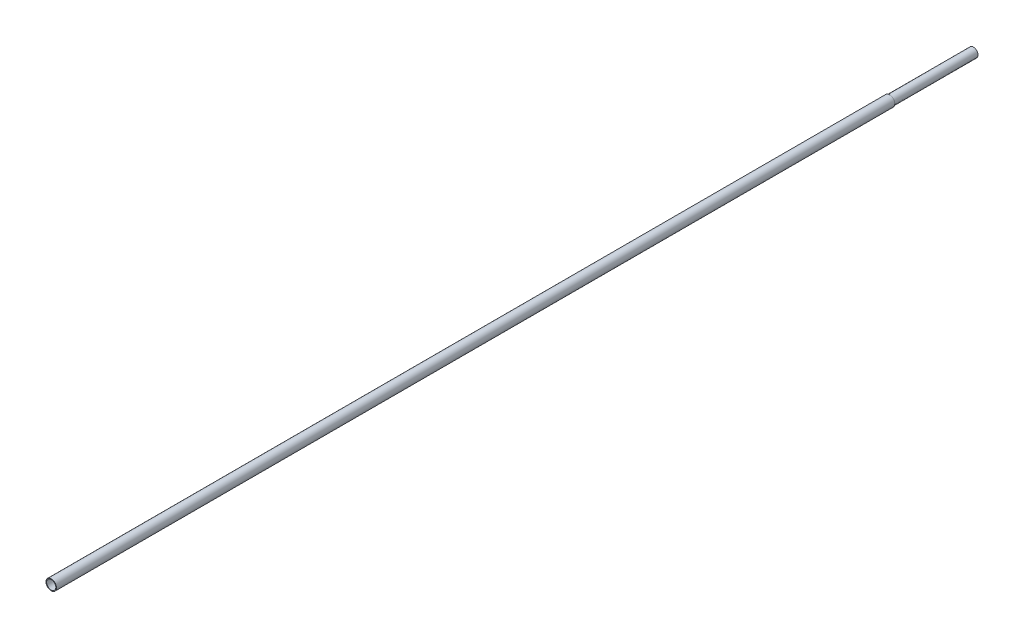
from build123d import *

# Parameters (mm, degrees)
SKETCH1_R                  = 25.4
SKETCH1_R_2                = 22.225
BOSS_EXTRUDE1_DEPTH        = 4064
SKETCH2_R                  = 6.35
CUT_EXTRUDE1_DEPTH         = 4065.1587469
LPATTERN1_COUNT            = 8
LPATTERN1_PITCH            = 25.4
LPATTERN2_COPY_1_SKETCH_R  = 6.35
LPATTERN2_COPY_1_DEPTH     = 4065.1587469
LPATTERN2_COPY_2_SKETCH_R  = 6.35
LPATTERN2_COPY_2_DEPTH     = 4065.1587469
LPATTERN2_COPY_3_SKETCH_R  = 6.35
LPATTERN2_COPY_3_DEPTH     = 4065.1587469
LPATTERN2_COPY_4_SKETCH_R  = 6.35
LPATTERN2_COPY_4_DEPTH     = 4065.1587469
LPATTERN2_COPY_5_SKETCH_R  = 6.35
LPATTERN2_COPY_5_DEPTH     = 4065.1587469
LPATTERN2_COPY_6_SKETCH_R  = 6.35
LPATTERN2_COPY_6_DEPTH     = 4065.1587469
LPATTERN2_COPY_7_SKETCH_R  = 6.35
LPATTERN2_COPY_7_DEPTH     = 4065.1587469
LPATTERN2_COPY_8_SKETCH_R  = 6.35
LPATTERN2_COPY_8_DEPTH     = 4065.1587469
LPATTERN2_COPY_9_SKETCH_R  = 6.35
LPATTERN2_COPY_9_DEPTH     = 4065.1587469
LPATTERN2_COPY_10_SKETCH_R = 6.35
LPATTERN2_COPY_10_DEPTH    = 4065.1587469
LPATTERN2_COPY_11_SKETCH_R = 6.35
LPATTERN2_COPY_11_DEPTH    = 4065.1587469
LPATTERN2_COPY_12_SKETCH_R = 6.35
LPATTERN2_COPY_12_DEPTH    = 4065.1587469
LPATTERN2_COPY_13_SKETCH_R = 6.35
LPATTERN2_COPY_13_DEPTH    = 4065.1587469
LPATTERN2_COPY_14_SKETCH_R = 6.35
LPATTERN2_COPY_14_DEPTH    = 4065.1587469
LPATTERN2_COPY_15_SKETCH_R = 6.35
LPATTERN2_COPY_15_DEPTH    = 4065.1587469
LPATTERN2_COPY_16_SKETCH_R = 6.35
LPATTERN2_COPY_16_DEPTH    = 4065.1587469
LPATTERN2_COPY_17_SKETCH_R = 6.35
LPATTERN2_COPY_17_DEPTH    = 4065.1587469
LPATTERN2_COPY_18_SKETCH_R = 6.35
LPATTERN2_COPY_18_DEPTH    = 4065.1587469
LPATTERN2_COPY_19_SKETCH_R = 6.35
LPATTERN2_COPY_19_DEPTH    = 4065.1587469
LPATTERN2_COPY_20_SKETCH_R = 6.35
LPATTERN2_COPY_20_DEPTH    = 4065.1587469
LPATTERN2_COPY_21_SKETCH_R = 6.35
LPATTERN2_COPY_21_DEPTH    = 4065.1587469
LPATTERN2_COPY_22_SKETCH_R = 6.35
LPATTERN2_COPY_22_DEPTH    = 4065.1587469
LPATTERN2_COPY_23_SKETCH_R = 6.35
LPATTERN2_COPY_23_DEPTH    = 4065.1587469
LPATTERN2_COPY_24_SKETCH_R = 6.35
LPATTERN2_COPY_24_DEPTH    = 4065.1587469
LPATTERN2_COPY_25_SKETCH_R = 6.35
LPATTERN2_COPY_25_DEPTH    = 4065.1587469
LPATTERN2_COPY_26_SKETCH_R = 6.35
LPATTERN2_COPY_26_DEPTH    = 4065.1587469
LPATTERN2_COPY_27_SKETCH_R = 6.35
LPATTERN2_COPY_27_DEPTH    = 4065.1587469
LPATTERN2_COPY_28_SKETCH_R = 6.35
LPATTERN2_COPY_28_DEPTH    = 4065.1587469
LPATTERN2_COPY_29_SKETCH_R = 6.35
LPATTERN2_COPY_29_DEPTH    = 4065.1587469
LPATTERN2_COPY_30_SKETCH_R = 6.35
LPATTERN2_COPY_30_DEPTH    = 4065.1587469
LPATTERN2_COPY_31_SKETCH_R = 6.35
LPATTERN2_COPY_31_DEPTH    = 4065.1587469
LPATTERN2_COPY_32_SKETCH_R = 6.35
LPATTERN2_COPY_32_DEPTH    = 4065.1587469
LPATTERN2_COPY_33_SKETCH_R = 6.35
LPATTERN2_COPY_33_DEPTH    = 4065.1587469
LPATTERN2_COPY_34_SKETCH_R = 6.35
LPATTERN2_COPY_34_DEPTH    = 4065.1587469
LPATTERN2_COPY_35_SKETCH_R = 6.35
LPATTERN2_COPY_35_DEPTH    = 4065.1587469
LPATTERN2_COPY_36_SKETCH_R = 6.35
LPATTERN2_COPY_36_DEPTH    = 4065.1587469
LPATTERN2_COPY_37_SKETCH_R = 6.35
LPATTERN2_COPY_37_DEPTH    = 4065.1587469
LPATTERN2_COPY_38_SKETCH_R = 6.35
LPATTERN2_COPY_38_DEPTH    = 4065.1587469
LPATTERN2_COPY_39_SKETCH_R = 6.35
LPATTERN2_COPY_39_DEPTH    = 4065.1587469
LPATTERN2_COPY_40_SKETCH_R = 6.35
LPATTERN2_COPY_40_DEPTH    = 4065.1587469
LPATTERN2_COPY_41_SKETCH_R = 6.35
LPATTERN2_COPY_41_DEPTH    = 4065.1587469
LPATTERN2_COPY_42_SKETCH_R = 6.35
LPATTERN2_COPY_42_DEPTH    = 4065.1587469
LPATTERN2_COPY_43_SKETCH_R = 6.35
LPATTERN2_COPY_43_DEPTH    = 4065.1587469
LPATTERN2_COPY_44_SKETCH_R = 6.35
LPATTERN2_COPY_44_DEPTH    = 4065.1587469
LPATTERN2_COPY_45_SKETCH_R = 6.35
LPATTERN2_COPY_45_DEPTH    = 4065.1587469
LPATTERN2_COPY_46_SKETCH_R = 6.35
LPATTERN2_COPY_46_DEPTH    = 4065.1587469
LPATTERN2_COPY_47_SKETCH_R = 6.35
LPATTERN2_COPY_47_DEPTH    = 4065.1587469
LPATTERN2_COPY_48_SKETCH_R = 6.35
LPATTERN2_COPY_48_DEPTH    = 4065.1587469
LPATTERN2_COPY_49_SKETCH_R = 6.35
LPATTERN2_COPY_49_DEPTH    = 4065.1587469
LPATTERN2_COPY_50_SKETCH_R = 6.35
LPATTERN2_COPY_50_DEPTH    = 4065.1587469
LPATTERN2_COPY_51_SKETCH_R = 6.35
LPATTERN2_COPY_51_DEPTH    = 4065.1587469
LPATTERN2_COPY_52_SKETCH_R = 6.35
LPATTERN2_COPY_52_DEPTH    = 4065.1587469
LPATTERN2_COPY_53_SKETCH_R = 6.35
LPATTERN2_COPY_53_DEPTH    = 4065.1587469
LPATTERN2_COPY_54_SKETCH_R = 6.35
LPATTERN2_COPY_54_DEPTH    = 4065.1587469
LPATTERN2_COPY_55_SKETCH_R = 6.35
LPATTERN2_COPY_55_DEPTH    = 4065.1587469
LPATTERN2_COPY_56_SKETCH_R = 6.35
LPATTERN2_COPY_56_DEPTH    = 4065.1587469
SKETCH3_R                  = 22.225
SKETCH3_R_2                = 19.05
BOSS_EXTRUDE2_DEPTH        = 406.4


with BuildPart() as part:
    # Sketch1 → Boss-Extrude1 (new body)
    with BuildSketch(Plane.XY):
        Circle(SKETCH1_R)
        Circle(SKETCH1_R_2, mode=Mode.SUBTRACT)
    extrude(amount=BOSS_EXTRUDE1_DEPTH)

    # Sketch2 → Cut-Extrude1 (cut, through all)
    with BuildSketch(Plane(origin=(0, 0, 0), x_dir=(1, 0, 0), z_dir=(0, 1, 0))):
        with Locations((0, -152.4)):
            Circle(SKETCH2_R)
    cut_extrude1 = extrude(amount=-CUT_EXTRUDE1_DEPTH, mode=Mode.SUBTRACT)

    # LPattern1: Cut-Extrude1 ×8
    with Locations(*[(0, 0, i * LPATTERN1_PITCH) for i in range(1, LPATTERN1_COUNT)]):
        add(cut_extrude1, mode=Mode.SUBTRACT)

    # LPattern2 copy 1 sketch → LPattern2 copy 1 (cut, through all)
    with BuildSketch(Plane(origin=(0, 0, 635), x_dir=(1, 0, 0), z_dir=(0, 1, 0))):
        with Locations((0, -152.4)):
            Circle(LPATTERN2_COPY_1_SKETCH_R)
    extrude(amount=-LPATTERN2_COPY_1_DEPTH, mode=Mode.SUBTRACT)

    # LPattern2 copy 2 sketch → LPattern2 copy 2 (cut, through all)
    with BuildSketch(Plane(origin=(0, 0, 1244.6), x_dir=(1, 0, 0), z_dir=(0, 1, 0))):
        with Locations((0, -152.4)):
            Circle(LPATTERN2_COPY_2_SKETCH_R)
    extrude(amount=-LPATTERN2_COPY_2_DEPTH, mode=Mode.SUBTRACT)

    # LPattern2 copy 3 sketch → LPattern2 copy 3 (cut, through all)
    with BuildSketch(Plane(origin=(0, 0, 1854.2), x_dir=(1, 0, 0), z_dir=(0, 1, 0))):
        with Locations((0, -152.4)):
            Circle(LPATTERN2_COPY_3_SKETCH_R)
    extrude(amount=-LPATTERN2_COPY_3_DEPTH, mode=Mode.SUBTRACT)

    # LPattern2 copy 4 sketch → LPattern2 copy 4 (cut, through all)
    with BuildSketch(Plane(origin=(0, 0, 2463.8), x_dir=(1, 0, 0), z_dir=(0, 1, 0))):
        with Locations((0, -152.4)):
            Circle(LPATTERN2_COPY_4_SKETCH_R)
    extrude(amount=-LPATTERN2_COPY_4_DEPTH, mode=Mode.SUBTRACT)

    # LPattern2 copy 5 sketch → LPattern2 copy 5 (cut, through all)
    with BuildSketch(Plane(origin=(0, 0, 3073.4), x_dir=(1, 0, 0), z_dir=(0, 1, 0))):
        with Locations((0, -152.4)):
            Circle(LPATTERN2_COPY_5_SKETCH_R)
    extrude(amount=-LPATTERN2_COPY_5_DEPTH, mode=Mode.SUBTRACT)

    # LPattern2 copy 6 sketch → LPattern2 copy 6 (cut, through all)
    with BuildSketch(Plane(origin=(0, 0, 3683), x_dir=(1, 0, 0), z_dir=(0, 1, 0))):
        with Locations((0, -152.4)):
            Circle(LPATTERN2_COPY_6_SKETCH_R)
    extrude(amount=-LPATTERN2_COPY_6_DEPTH, mode=Mode.SUBTRACT)

    # LPattern2 copy 7 sketch → LPattern2 copy 7 (cut, through all)
    with BuildSketch(Plane(origin=(0, 0, 4292.6), x_dir=(1, 0, 0), z_dir=(0, 1, 0))):
        with Locations((0, -152.4)):
            Circle(LPATTERN2_COPY_7_SKETCH_R)
    extrude(amount=-LPATTERN2_COPY_7_DEPTH, mode=Mode.SUBTRACT)

    # LPattern2 copy 8 sketch → LPattern2 copy 8 (cut, through all)
    with BuildSketch(Plane(origin=(0, 0, 660.4), x_dir=(1, 0, 0), z_dir=(0, 1, 0))):
        with Locations((0, -152.4)):
            Circle(LPATTERN2_COPY_8_SKETCH_R)
    extrude(amount=-LPATTERN2_COPY_8_DEPTH, mode=Mode.SUBTRACT)

    # LPattern2 copy 9 sketch → LPattern2 copy 9 (cut, through all)
    with BuildSketch(Plane(origin=(0, 0, 1270), x_dir=(1, 0, 0), z_dir=(0, 1, 0))):
        with Locations((0, -152.4)):
            Circle(LPATTERN2_COPY_9_SKETCH_R)
    extrude(amount=-LPATTERN2_COPY_9_DEPTH, mode=Mode.SUBTRACT)

    # LPattern2 copy 10 sketch → LPattern2 copy 10 (cut, through all)
    with BuildSketch(Plane(origin=(0, 0, 1879.6), x_dir=(1, 0, 0), z_dir=(0, 1, 0))):
        with Locations((0, -152.4)):
            Circle(LPATTERN2_COPY_10_SKETCH_R)
    extrude(amount=-LPATTERN2_COPY_10_DEPTH, mode=Mode.SUBTRACT)

    # LPattern2 copy 11 sketch → LPattern2 copy 11 (cut, through all)
    with BuildSketch(Plane(origin=(0, 0, 2489.2), x_dir=(1, 0, 0), z_dir=(0, 1, 0))):
        with Locations((0, -152.4)):
            Circle(LPATTERN2_COPY_11_SKETCH_R)
    extrude(amount=-LPATTERN2_COPY_11_DEPTH, mode=Mode.SUBTRACT)

    # LPattern2 copy 12 sketch → LPattern2 copy 12 (cut, through all)
    with BuildSketch(Plane(origin=(0, 0, 3098.8), x_dir=(1, 0, 0), z_dir=(0, 1, 0))):
        with Locations((0, -152.4)):
            Circle(LPATTERN2_COPY_12_SKETCH_R)
    extrude(amount=-LPATTERN2_COPY_12_DEPTH, mode=Mode.SUBTRACT)

    # LPattern2 copy 13 sketch → LPattern2 copy 13 (cut, through all)
    with BuildSketch(Plane(origin=(0, 0, 3708.4), x_dir=(1, 0, 0), z_dir=(0, 1, 0))):
        with Locations((0, -152.4)):
            Circle(LPATTERN2_COPY_13_SKETCH_R)
    extrude(amount=-LPATTERN2_COPY_13_DEPTH, mode=Mode.SUBTRACT)

    # LPattern2 copy 14 sketch → LPattern2 copy 14 (cut, through all)
    with BuildSketch(Plane(origin=(0, 0, 4318), x_dir=(1, 0, 0), z_dir=(0, 1, 0))):
        with Locations((0, -152.4)):
            Circle(LPATTERN2_COPY_14_SKETCH_R)
    extrude(amount=-LPATTERN2_COPY_14_DEPTH, mode=Mode.SUBTRACT)

    # LPattern2 copy 15 sketch → LPattern2 copy 15 (cut, through all)
    with BuildSketch(Plane(origin=(0, 0, 685.8), x_dir=(1, 0, 0), z_dir=(0, 1, 0))):
        with Locations((0, -152.4)):
            Circle(LPATTERN2_COPY_15_SKETCH_R)
    extrude(amount=-LPATTERN2_COPY_15_DEPTH, mode=Mode.SUBTRACT)

    # LPattern2 copy 16 sketch → LPattern2 copy 16 (cut, through all)
    with BuildSketch(Plane(origin=(0, 0, 1295.4), x_dir=(1, 0, 0), z_dir=(0, 1, 0))):
        with Locations((0, -152.4)):
            Circle(LPATTERN2_COPY_16_SKETCH_R)
    extrude(amount=-LPATTERN2_COPY_16_DEPTH, mode=Mode.SUBTRACT)

    # LPattern2 copy 17 sketch → LPattern2 copy 17 (cut, through all)
    with BuildSketch(Plane(origin=(0, 0, 1905), x_dir=(1, 0, 0), z_dir=(0, 1, 0))):
        with Locations((0, -152.4)):
            Circle(LPATTERN2_COPY_17_SKETCH_R)
    extrude(amount=-LPATTERN2_COPY_17_DEPTH, mode=Mode.SUBTRACT)

    # LPattern2 copy 18 sketch → LPattern2 copy 18 (cut, through all)
    with BuildSketch(Plane(origin=(0, 0, 2514.6), x_dir=(1, 0, 0), z_dir=(0, 1, 0))):
        with Locations((0, -152.4)):
            Circle(LPATTERN2_COPY_18_SKETCH_R)
    extrude(amount=-LPATTERN2_COPY_18_DEPTH, mode=Mode.SUBTRACT)

    # LPattern2 copy 19 sketch → LPattern2 copy 19 (cut, through all)
    with BuildSketch(Plane(origin=(0, 0, 3124.2), x_dir=(1, 0, 0), z_dir=(0, 1, 0))):
        with Locations((0, -152.4)):
            Circle(LPATTERN2_COPY_19_SKETCH_R)
    extrude(amount=-LPATTERN2_COPY_19_DEPTH, mode=Mode.SUBTRACT)

    # LPattern2 copy 20 sketch → LPattern2 copy 20 (cut, through all)
    with BuildSketch(Plane(origin=(0, 0, 3733.8), x_dir=(1, 0, 0), z_dir=(0, 1, 0))):
        with Locations((0, -152.4)):
            Circle(LPATTERN2_COPY_20_SKETCH_R)
    extrude(amount=-LPATTERN2_COPY_20_DEPTH, mode=Mode.SUBTRACT)

    # LPattern2 copy 21 sketch → LPattern2 copy 21 (cut, through all)
    with BuildSketch(Plane(origin=(0, 0, 4343.4), x_dir=(1, 0, 0), z_dir=(0, 1, 0))):
        with Locations((0, -152.4)):
            Circle(LPATTERN2_COPY_21_SKETCH_R)
    extrude(amount=-LPATTERN2_COPY_21_DEPTH, mode=Mode.SUBTRACT)

    # LPattern2 copy 22 sketch → LPattern2 copy 22 (cut, through all)
    with BuildSketch(Plane(origin=(0, 0, 711.2), x_dir=(1, 0, 0), z_dir=(0, 1, 0))):
        with Locations((0, -152.4)):
            Circle(LPATTERN2_COPY_22_SKETCH_R)
    extrude(amount=-LPATTERN2_COPY_22_DEPTH, mode=Mode.SUBTRACT)

    # LPattern2 copy 23 sketch → LPattern2 copy 23 (cut, through all)
    with BuildSketch(Plane(origin=(0, 0, 1320.8), x_dir=(1, 0, 0), z_dir=(0, 1, 0))):
        with Locations((0, -152.4)):
            Circle(LPATTERN2_COPY_23_SKETCH_R)
    extrude(amount=-LPATTERN2_COPY_23_DEPTH, mode=Mode.SUBTRACT)

    # LPattern2 copy 24 sketch → LPattern2 copy 24 (cut, through all)
    with BuildSketch(Plane(origin=(0, 0, 1930.4), x_dir=(1, 0, 0), z_dir=(0, 1, 0))):
        with Locations((0, -152.4)):
            Circle(LPATTERN2_COPY_24_SKETCH_R)
    extrude(amount=-LPATTERN2_COPY_24_DEPTH, mode=Mode.SUBTRACT)

    # LPattern2 copy 25 sketch → LPattern2 copy 25 (cut, through all)
    with BuildSketch(Plane(origin=(0, 0, 2540), x_dir=(1, 0, 0), z_dir=(0, 1, 0))):
        with Locations((0, -152.4)):
            Circle(LPATTERN2_COPY_25_SKETCH_R)
    extrude(amount=-LPATTERN2_COPY_25_DEPTH, mode=Mode.SUBTRACT)

    # LPattern2 copy 26 sketch → LPattern2 copy 26 (cut, through all)
    with BuildSketch(Plane(origin=(0, 0, 3149.6), x_dir=(1, 0, 0), z_dir=(0, 1, 0))):
        with Locations((0, -152.4)):
            Circle(LPATTERN2_COPY_26_SKETCH_R)
    extrude(amount=-LPATTERN2_COPY_26_DEPTH, mode=Mode.SUBTRACT)

    # LPattern2 copy 27 sketch → LPattern2 copy 27 (cut, through all)
    with BuildSketch(Plane(origin=(0, 0, 3759.2), x_dir=(1, 0, 0), z_dir=(0, 1, 0))):
        with Locations((0, -152.4)):
            Circle(LPATTERN2_COPY_27_SKETCH_R)
    extrude(amount=-LPATTERN2_COPY_27_DEPTH, mode=Mode.SUBTRACT)

    # LPattern2 copy 28 sketch → LPattern2 copy 28 (cut, through all)
    with BuildSketch(Plane(origin=(0, 0, 4368.8), x_dir=(1, 0, 0), z_dir=(0, 1, 0))):
        with Locations((0, -152.4)):
            Circle(LPATTERN2_COPY_28_SKETCH_R)
    extrude(amount=-LPATTERN2_COPY_28_DEPTH, mode=Mode.SUBTRACT)

    # LPattern2 copy 29 sketch → LPattern2 copy 29 (cut, through all)
    with BuildSketch(Plane(origin=(0, 0, 736.6), x_dir=(1, 0, 0), z_dir=(0, 1, 0))):
        with Locations((0, -152.4)):
            Circle(LPATTERN2_COPY_29_SKETCH_R)
    extrude(amount=-LPATTERN2_COPY_29_DEPTH, mode=Mode.SUBTRACT)

    # LPattern2 copy 30 sketch → LPattern2 copy 30 (cut, through all)
    with BuildSketch(Plane(origin=(0, 0, 1346.2), x_dir=(1, 0, 0), z_dir=(0, 1, 0))):
        with Locations((0, -152.4)):
            Circle(LPATTERN2_COPY_30_SKETCH_R)
    extrude(amount=-LPATTERN2_COPY_30_DEPTH, mode=Mode.SUBTRACT)

    # LPattern2 copy 31 sketch → LPattern2 copy 31 (cut, through all)
    with BuildSketch(Plane(origin=(0, 0, 1955.8), x_dir=(1, 0, 0), z_dir=(0, 1, 0))):
        with Locations((0, -152.4)):
            Circle(LPATTERN2_COPY_31_SKETCH_R)
    extrude(amount=-LPATTERN2_COPY_31_DEPTH, mode=Mode.SUBTRACT)

    # LPattern2 copy 32 sketch → LPattern2 copy 32 (cut, through all)
    with BuildSketch(Plane(origin=(0, 0, 2565.4), x_dir=(1, 0, 0), z_dir=(0, 1, 0))):
        with Locations((0, -152.4)):
            Circle(LPATTERN2_COPY_32_SKETCH_R)
    extrude(amount=-LPATTERN2_COPY_32_DEPTH, mode=Mode.SUBTRACT)

    # LPattern2 copy 33 sketch → LPattern2 copy 33 (cut, through all)
    with BuildSketch(Plane(origin=(0, 0, 3175), x_dir=(1, 0, 0), z_dir=(0, 1, 0))):
        with Locations((0, -152.4)):
            Circle(LPATTERN2_COPY_33_SKETCH_R)
    extrude(amount=-LPATTERN2_COPY_33_DEPTH, mode=Mode.SUBTRACT)

    # LPattern2 copy 34 sketch → LPattern2 copy 34 (cut, through all)
    with BuildSketch(Plane(origin=(0, 0, 3784.6), x_dir=(1, 0, 0), z_dir=(0, 1, 0))):
        with Locations((0, -152.4)):
            Circle(LPATTERN2_COPY_34_SKETCH_R)
    extrude(amount=-LPATTERN2_COPY_34_DEPTH, mode=Mode.SUBTRACT)

    # LPattern2 copy 35 sketch → LPattern2 copy 35 (cut, through all)
    with BuildSketch(Plane(origin=(0, 0, 4394.2), x_dir=(1, 0, 0), z_dir=(0, 1, 0))):
        with Locations((0, -152.4)):
            Circle(LPATTERN2_COPY_35_SKETCH_R)
    extrude(amount=-LPATTERN2_COPY_35_DEPTH, mode=Mode.SUBTRACT)

    # LPattern2 copy 36 sketch → LPattern2 copy 36 (cut, through all)
    with BuildSketch(Plane(origin=(0, 0, 762), x_dir=(1, 0, 0), z_dir=(0, 1, 0))):
        with Locations((0, -152.4)):
            Circle(LPATTERN2_COPY_36_SKETCH_R)
    extrude(amount=-LPATTERN2_COPY_36_DEPTH, mode=Mode.SUBTRACT)

    # LPattern2 copy 37 sketch → LPattern2 copy 37 (cut, through all)
    with BuildSketch(Plane(origin=(0, 0, 1371.6), x_dir=(1, 0, 0), z_dir=(0, 1, 0))):
        with Locations((0, -152.4)):
            Circle(LPATTERN2_COPY_37_SKETCH_R)
    extrude(amount=-LPATTERN2_COPY_37_DEPTH, mode=Mode.SUBTRACT)

    # LPattern2 copy 38 sketch → LPattern2 copy 38 (cut, through all)
    with BuildSketch(Plane(origin=(0, 0, 1981.2), x_dir=(1, 0, 0), z_dir=(0, 1, 0))):
        with Locations((0, -152.4)):
            Circle(LPATTERN2_COPY_38_SKETCH_R)
    extrude(amount=-LPATTERN2_COPY_38_DEPTH, mode=Mode.SUBTRACT)

    # LPattern2 copy 39 sketch → LPattern2 copy 39 (cut, through all)
    with BuildSketch(Plane(origin=(0, 0, 2590.8), x_dir=(1, 0, 0), z_dir=(0, 1, 0))):
        with Locations((0, -152.4)):
            Circle(LPATTERN2_COPY_39_SKETCH_R)
    extrude(amount=-LPATTERN2_COPY_39_DEPTH, mode=Mode.SUBTRACT)

    # LPattern2 copy 40 sketch → LPattern2 copy 40 (cut, through all)
    with BuildSketch(Plane(origin=(0, 0, 3200.4), x_dir=(1, 0, 0), z_dir=(0, 1, 0))):
        with Locations((0, -152.4)):
            Circle(LPATTERN2_COPY_40_SKETCH_R)
    extrude(amount=-LPATTERN2_COPY_40_DEPTH, mode=Mode.SUBTRACT)

    # LPattern2 copy 41 sketch → LPattern2 copy 41 (cut, through all)
    with BuildSketch(Plane(origin=(0, 0, 3810), x_dir=(1, 0, 0), z_dir=(0, 1, 0))):
        with Locations((0, -152.4)):
            Circle(LPATTERN2_COPY_41_SKETCH_R)
    extrude(amount=-LPATTERN2_COPY_41_DEPTH, mode=Mode.SUBTRACT)

    # LPattern2 copy 42 sketch → LPattern2 copy 42 (cut, through all)
    with BuildSketch(Plane(origin=(0, 0, 4419.6), x_dir=(1, 0, 0), z_dir=(0, 1, 0))):
        with Locations((0, -152.4)):
            Circle(LPATTERN2_COPY_42_SKETCH_R)
    extrude(amount=-LPATTERN2_COPY_42_DEPTH, mode=Mode.SUBTRACT)

    # LPattern2 copy 43 sketch → LPattern2 copy 43 (cut, through all)
    with BuildSketch(Plane(origin=(0, 0, 787.4), x_dir=(1, 0, 0), z_dir=(0, 1, 0))):
        with Locations((0, -152.4)):
            Circle(LPATTERN2_COPY_43_SKETCH_R)
    extrude(amount=-LPATTERN2_COPY_43_DEPTH, mode=Mode.SUBTRACT)

    # LPattern2 copy 44 sketch → LPattern2 copy 44 (cut, through all)
    with BuildSketch(Plane(origin=(0, 0, 1397), x_dir=(1, 0, 0), z_dir=(0, 1, 0))):
        with Locations((0, -152.4)):
            Circle(LPATTERN2_COPY_44_SKETCH_R)
    extrude(amount=-LPATTERN2_COPY_44_DEPTH, mode=Mode.SUBTRACT)

    # LPattern2 copy 45 sketch → LPattern2 copy 45 (cut, through all)
    with BuildSketch(Plane(origin=(0, 0, 2006.6), x_dir=(1, 0, 0), z_dir=(0, 1, 0))):
        with Locations((0, -152.4)):
            Circle(LPATTERN2_COPY_45_SKETCH_R)
    extrude(amount=-LPATTERN2_COPY_45_DEPTH, mode=Mode.SUBTRACT)

    # LPattern2 copy 46 sketch → LPattern2 copy 46 (cut, through all)
    with BuildSketch(Plane(origin=(0, 0, 2616.2), x_dir=(1, 0, 0), z_dir=(0, 1, 0))):
        with Locations((0, -152.4)):
            Circle(LPATTERN2_COPY_46_SKETCH_R)
    extrude(amount=-LPATTERN2_COPY_46_DEPTH, mode=Mode.SUBTRACT)

    # LPattern2 copy 47 sketch → LPattern2 copy 47 (cut, through all)
    with BuildSketch(Plane(origin=(0, 0, 3225.8), x_dir=(1, 0, 0), z_dir=(0, 1, 0))):
        with Locations((0, -152.4)):
            Circle(LPATTERN2_COPY_47_SKETCH_R)
    extrude(amount=-LPATTERN2_COPY_47_DEPTH, mode=Mode.SUBTRACT)

    # LPattern2 copy 48 sketch → LPattern2 copy 48 (cut, through all)
    with BuildSketch(Plane(origin=(0, 0, 3835.4), x_dir=(1, 0, 0), z_dir=(0, 1, 0))):
        with Locations((0, -152.4)):
            Circle(LPATTERN2_COPY_48_SKETCH_R)
    extrude(amount=-LPATTERN2_COPY_48_DEPTH, mode=Mode.SUBTRACT)

    # LPattern2 copy 49 sketch → LPattern2 copy 49 (cut, through all)
    with BuildSketch(Plane(origin=(0, 0, 4445), x_dir=(1, 0, 0), z_dir=(0, 1, 0))):
        with Locations((0, -152.4)):
            Circle(LPATTERN2_COPY_49_SKETCH_R)
    extrude(amount=-LPATTERN2_COPY_49_DEPTH, mode=Mode.SUBTRACT)

    # LPattern2 copy 50 sketch → LPattern2 copy 50 (cut, through all)
    with BuildSketch(Plane(origin=(0, 0, 609.6), x_dir=(1, 0, 0), z_dir=(0, 1, 0))):
        with Locations((0, -152.4)):
            Circle(LPATTERN2_COPY_50_SKETCH_R)
    extrude(amount=-LPATTERN2_COPY_50_DEPTH, mode=Mode.SUBTRACT)

    # LPattern2 copy 51 sketch → LPattern2 copy 51 (cut, through all)
    with BuildSketch(Plane(origin=(0, 0, 1219.2), x_dir=(1, 0, 0), z_dir=(0, 1, 0))):
        with Locations((0, -152.4)):
            Circle(LPATTERN2_COPY_51_SKETCH_R)
    extrude(amount=-LPATTERN2_COPY_51_DEPTH, mode=Mode.SUBTRACT)

    # LPattern2 copy 52 sketch → LPattern2 copy 52 (cut, through all)
    with BuildSketch(Plane(origin=(0, 0, 1828.8), x_dir=(1, 0, 0), z_dir=(0, 1, 0))):
        with Locations((0, -152.4)):
            Circle(LPATTERN2_COPY_52_SKETCH_R)
    extrude(amount=-LPATTERN2_COPY_52_DEPTH, mode=Mode.SUBTRACT)

    # LPattern2 copy 53 sketch → LPattern2 copy 53 (cut, through all)
    with BuildSketch(Plane(origin=(0, 0, 2438.4), x_dir=(1, 0, 0), z_dir=(0, 1, 0))):
        with Locations((0, -152.4)):
            Circle(LPATTERN2_COPY_53_SKETCH_R)
    extrude(amount=-LPATTERN2_COPY_53_DEPTH, mode=Mode.SUBTRACT)

    # LPattern2 copy 54 sketch → LPattern2 copy 54 (cut, through all)
    with BuildSketch(Plane(origin=(0, 0, 3048), x_dir=(1, 0, 0), z_dir=(0, 1, 0))):
        with Locations((0, -152.4)):
            Circle(LPATTERN2_COPY_54_SKETCH_R)
    extrude(amount=-LPATTERN2_COPY_54_DEPTH, mode=Mode.SUBTRACT)

    # LPattern2 copy 55 sketch → LPattern2 copy 55 (cut, through all)
    with BuildSketch(Plane(origin=(0, 0, 3657.6), x_dir=(1, 0, 0), z_dir=(0, 1, 0))):
        with Locations((0, -152.4)):
            Circle(LPATTERN2_COPY_55_SKETCH_R)
    extrude(amount=-LPATTERN2_COPY_55_DEPTH, mode=Mode.SUBTRACT)

    # LPattern2 copy 56 sketch → LPattern2 copy 56 (cut, through all)
    with BuildSketch(Plane(origin=(0, 0, 4267.2), x_dir=(1, 0, 0), z_dir=(0, 1, 0))):
        with Locations((0, -152.4)):
            Circle(LPATTERN2_COPY_56_SKETCH_R)
    extrude(amount=-LPATTERN2_COPY_56_DEPTH, mode=Mode.SUBTRACT)


with BuildPart() as body_2:
    # Sketch3 → Boss-Extrude2 (new body)
    with BuildSketch(Plane(origin=(0, 0, 0), x_dir=(-1, 0, 0), z_dir=(0, 0, -1))):
        Circle(SKETCH3_R)
        Circle(SKETCH3_R_2, mode=Mode.SUBTRACT)
    extrude(amount=BOSS_EXTRUDE2_DEPTH)


solid = Compound([part.part, body_2.part])
